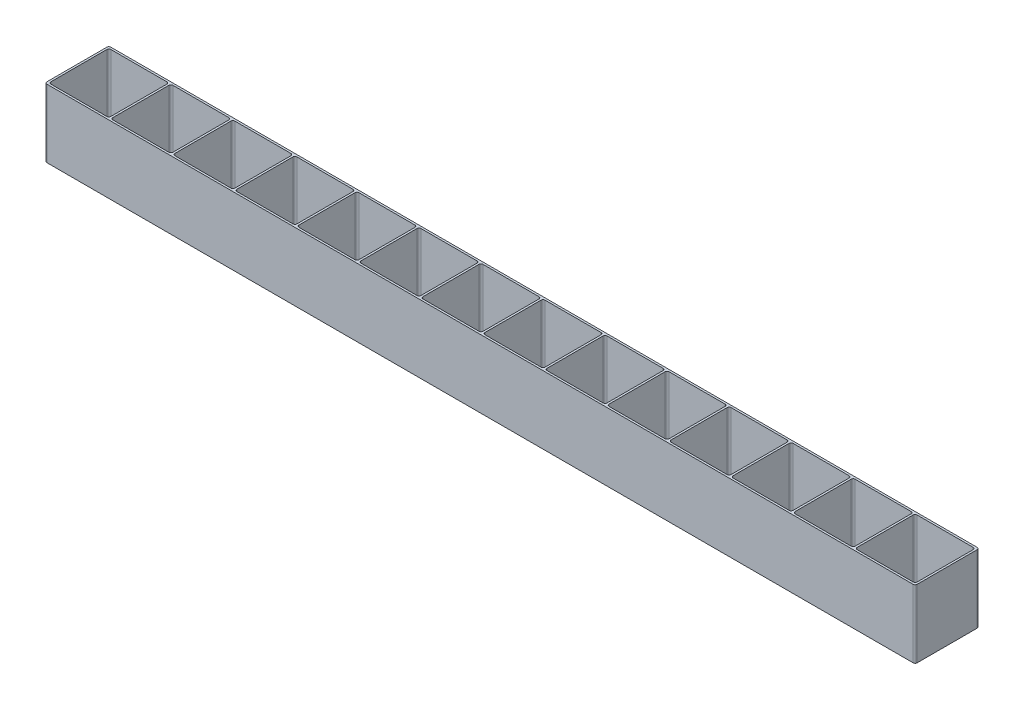
from build123d import *

# Parameters (mm, degrees)
SKETCH1_W              = 870
SKETCH1_H              = 68
BOSS_EXTRUDE1_DEPTH    = 64
SKETCH2_W              = 60
SKETCH2_H              = 60
CUT_EXTRUDE1_DEPTH     = 65
FILLET2_R              = 2
FILLET1_R              = 2
LPATTERN2_COUNT        = 14
LPATTERN2_PITCH        = 62
FILLET2_OF_LPATTERN2_R = 2


with BuildPart() as part:
    # Sketch1 → Boss-Extrude1 (new body)
    with BuildSketch(Plane.XY):
        Rectangle(SKETCH1_W, SKETCH1_H)
    extrude(amount=BOSS_EXTRUDE1_DEPTH)

    # Sketch2 → Cut-Extrude1 (cut)
    with BuildSketch(Plane(origin=(0, 34, 0), x_dir=(1, 0, 0), z_dir=(0, 1, 0))):
        with Locations((-403, -32)):
            Rectangle(SKETCH2_W, SKETCH2_H)
    cut_extrude1 = extrude(amount=-CUT_EXTRUDE1_DEPTH, mode=Mode.SUBTRACT)

    # Fillet2
    fillet2_edges = [part.edges().sort_by_distance(p)[0] for p in [
        (-433, 1.5, 62),
        (-373, 1.5, 62),
        (-433, 1.5, 2),
        (-373, 1.5, 2),
    ]]
    fillet(fillet2_edges, radius=FILLET2_R)

    # Fillet1
    fillet1_edges = [part.edges().sort_by_distance(p)[0] for p in [
        (-435, 0, 64),
        (-435, 0, 0),
        (435, 0, 64),
        (435, 0, 0),
    ]]
    fillet(fillet1_edges, radius=FILLET1_R)

    # LPattern2: Cut-Extrude1 ×14
    with Locations(*[(i * LPATTERN2_PITCH, 0, 0) for i in range(1, LPATTERN2_COUNT)]):
        add(cut_extrude1, mode=Mode.SUBTRACT)

    # Fillet2 of LPattern2
    fillet2_of_lpattern2_edges = [part.edges().sort_by_distance(p)[0] for p in [
        (-371, 1.5, 62),
        (-311, 1.5, 62),
        (-371, 1.5, 2),
        (-311, 1.5, 2),
        (-309, 1.5, 62),
        (-249, 1.5, 62),
        (-309, 1.5, 2),
        (-249, 1.5, 2),
        (-247, 1.5, 62),
        (-187, 1.5, 62),
        (-247, 1.5, 2),
        (-187, 1.5, 2),
        (-185, 1.5, 62),
        (-125, 1.5, 62),
        (-185, 1.5, 2),
        (-125, 1.5, 2),
        (-123, 1.5, 62),
        (-63, 1.5, 62),
        (-123, 1.5, 2),
        (-63, 1.5, 2),
        (-61, 1.5, 62),
        (-1, 1.5, 62),
        (-61, 1.5, 2),
        (-1, 1.5, 2),
        (1, 1.5, 62),
        (61, 1.5, 62),
        (1, 1.5, 2),
        (61, 1.5, 2),
        (63, 1.5, 62),
        (123, 1.5, 62),
        (63, 1.5, 2),
        (123, 1.5, 2),
        (125, 1.5, 62),
        (185, 1.5, 62),
        (125, 1.5, 2),
        (185, 1.5, 2),
        (187, 1.5, 62),
        (247, 1.5, 62),
        (187, 1.5, 2),
        (247, 1.5, 2),
        (249, 1.5, 62),
        (309, 1.5, 62),
        (249, 1.5, 2),
        (309, 1.5, 2),
        (311, 1.5, 62),
        (371, 1.5, 62),
        (311, 1.5, 2),
        (371, 1.5, 2),
        (373, 1.5, 62),
        (433, 1.5, 62),
        (373, 1.5, 2),
        (433, 1.5, 2),
    ]]
    fillet(fillet2_of_lpattern2_edges, radius=FILLET2_OF_LPATTERN2_R)


solid = part.part
